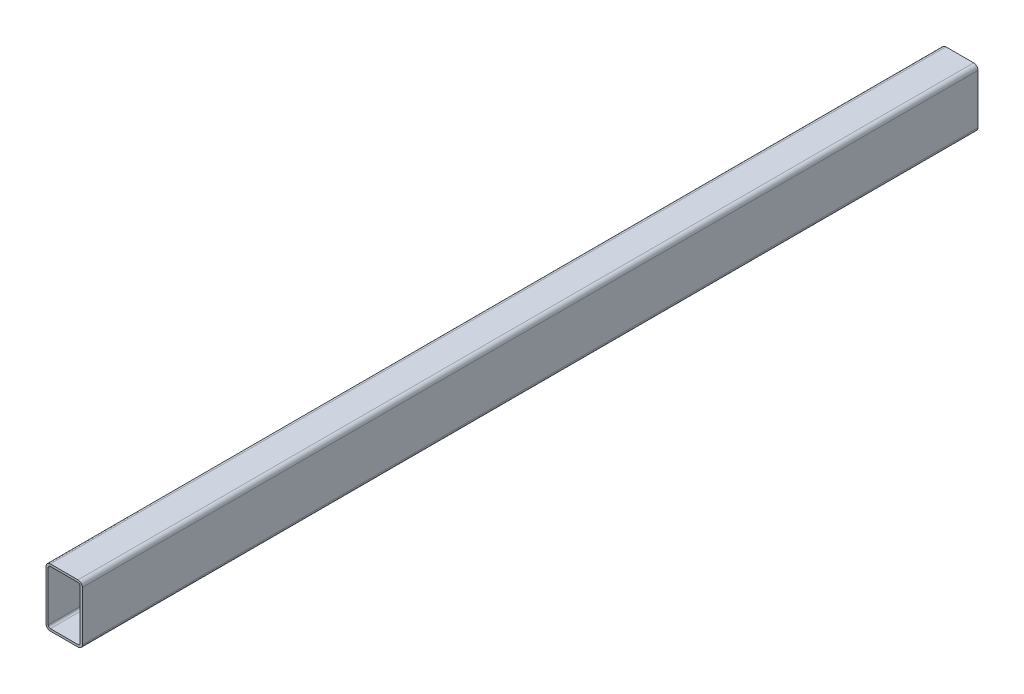
from build123d import *

# Parameters (mm, degrees)
BOSS_EXTRUDE1_DEPTH = 615


with BuildPart() as part:
    # Sketch1 → Boss-Extrude1 (new, symmetric)
    with BuildSketch(Plane.XY):
        with BuildLine():
            Line((19, -40), (-19, -40))
            ThreePointArc((-19, -40), (-23.242640687, -38.242640687), (-25, -34))
            Line((-25, -34), (-25, 34))
            ThreePointArc((-25, 34), (-23.242640687, 38.242640687), (-19, 40))
            Line((-19, 40), (19, 40))
            ThreePointArc((19, 40), (23.242640687, 38.242640687), (25, 34))
            Line((25, 34), (25, -34))
            ThreePointArc((25, -34), (23.242640687, -38.242640687), (19, -40))
        make_face()
        with BuildLine():
            Line((19, 37), (-19, 37))
            ThreePointArc((-19, 37), (-21.121320344, 36.121320344), (-22, 34))
            Line((-22, 34), (-22, -34))
            ThreePointArc((-22, -34), (-21.121320344, -36.121320344), (-19, -37))
            Line((-19, -37), (19, -37))
            ThreePointArc((19, -37), (21.121320344, -36.121320344), (22, -34))
            Line((22, -34), (22, 34))
            ThreePointArc((22, 34), (21.121320344, 36.121320344), (19, 37))
        make_face(mode=Mode.SUBTRACT)
    extrude(amount=BOSS_EXTRUDE1_DEPTH, both=True)


solid = part.part
